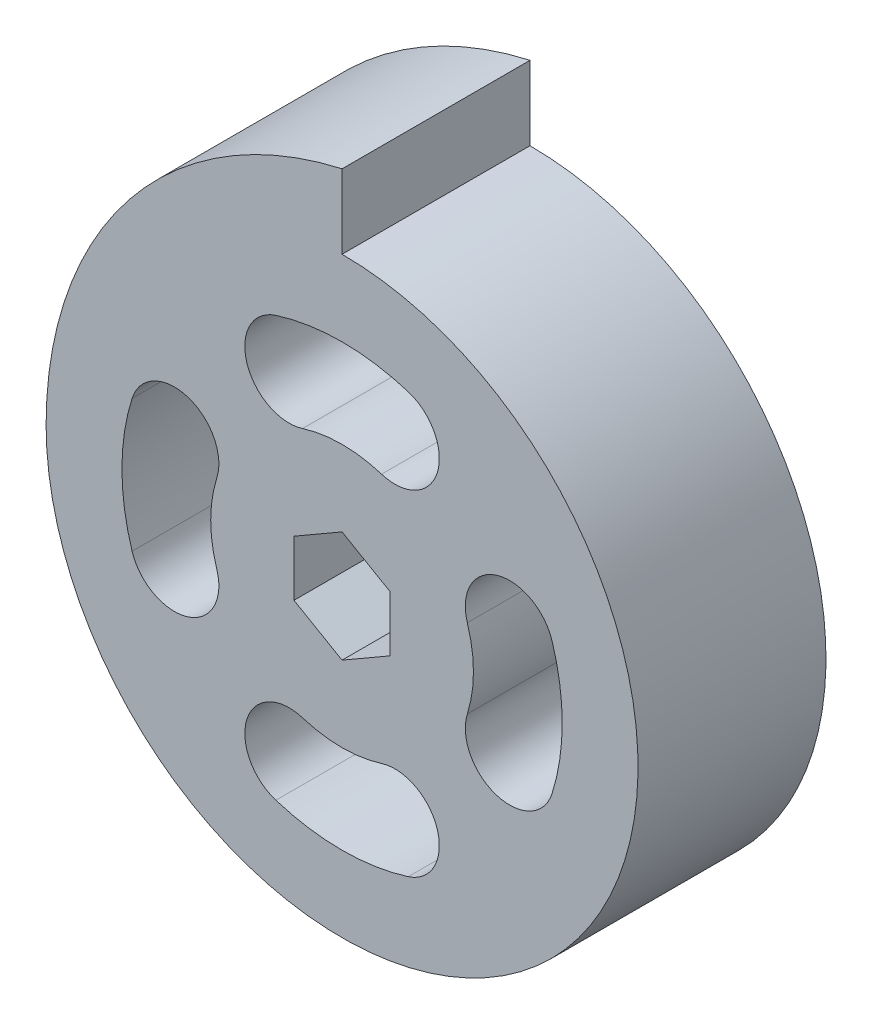
from build123d import *

# Parameters (mm, degrees)
BOSS_EXTRUDE1_DEPTH = 12.7
CUT_EXTRUDE1_DEPTH  = 35.44256088
CIRPATTERN1_COUNT   = 4


with BuildPart() as part:
    # Sketch3 → Boss-Extrude1 (new body)
    with BuildSketch(Plane.XY):
        with BuildLine():
            Line((0, 20), (0, 25))
            ThreePointArc((0, 25), (-14.384763242, 16.007810594), (-20, 0))
            ThreePointArc((-20, 0), (14.142135624, -14.142135624), (0, 20))
        make_face()
        Polygon((3.25, -1.876388375), (3.25, 1.876388375), (0, 3.75277675), (-3.25, 1.876388375), (-3.25, -1.876388375), (0, -3.75277675), align=None, mode=Mode.SUBTRACT)
    extrude(amount=BOSS_EXTRUDE1_DEPTH)

    # Sketch4 → Cut-Extrude1 (cut, through all)
    with BuildSketch(Plane.XY.offset(12.7)):
        with BuildLine():
            ThreePointArc((-4.47341626, 14.187863759), (0, 14.876388375), (4.47341626, 14.187863759))
            ThreePointArc((4.47341626, 14.187863759), (6.432449714, 10.424595508), (2.669181463, 8.465562055))
            ThreePointArc((2.669181463, 8.465562055), (0, 8.876388375), (-2.669181463, 8.465562055))
            ThreePointArc((-2.669181463, 8.465562055), (-6.432449714, 10.424595508), (-4.47341626, 14.187863759))
        make_face()
    cut_extrude1 = extrude(amount=-CUT_EXTRUDE1_DEPTH, mode=Mode.SUBTRACT)

    # CirPattern1: Cut-Extrude1 ×4 about axis
    cirpattern1_axis = Axis((0, 0, -0.475), (0, 0, 1))
    for i in range(1, CIRPATTERN1_COUNT):
        add(cut_extrude1.rotate(cirpattern1_axis, i * 360 / CIRPATTERN1_COUNT), mode=Mode.SUBTRACT)


solid = part.part
